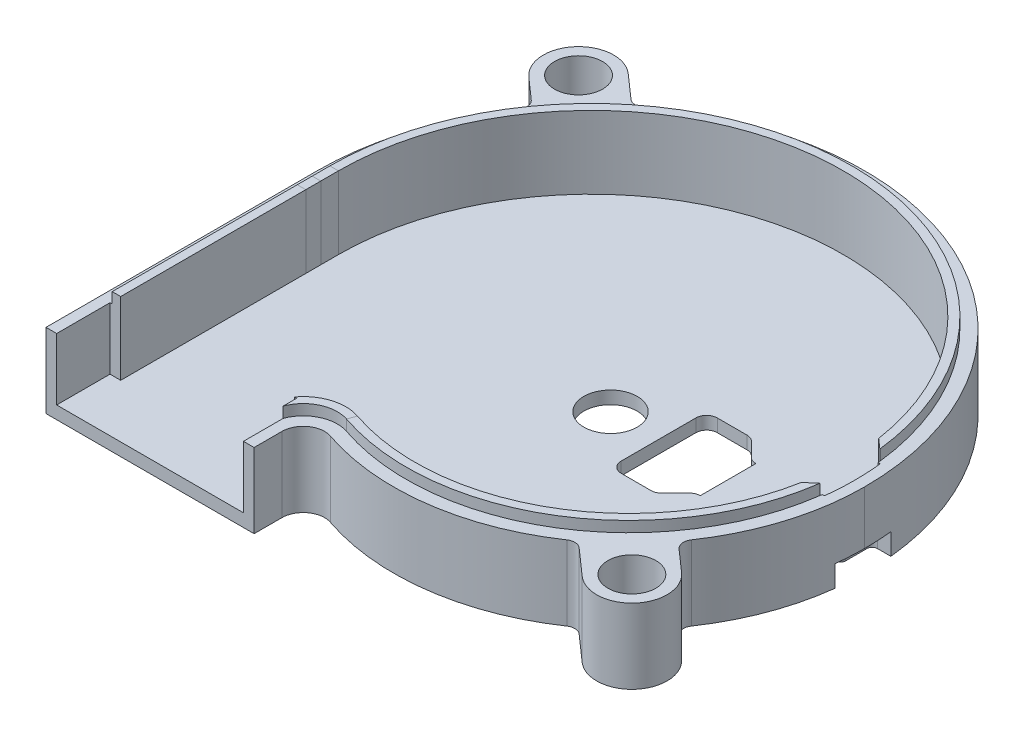
from build123d import *

# Parameters (mm, degrees)
SKETCH_1_R          = 2.25
SKETCH_1_R_2        = 2.5
EXTRUDE_1_DEPTH     = 8
CUT_EXTRUDE_1_DEPTH = 6.8
SKETCH_3_OUTSIDE_W  = 67.866
SKETCH_3_OUTSIDE_H  = 67.633
CUT_EXTRUDE_4_DEPTH = 1
SKETCH_5_R          = 2.825
SKETCH_5_R_2        = 2.25
EXTRUDE_2_DEPTH     = 1.5
CUT_EXTRUDE_5_DEPTH = 0.5
CUT_EXTRUDE_6_DEPTH = 2
FILLET_1_R          = 1
SKETCH_8_W          = 2.5
SKETCH_8_H          = 0.8
EXTRUDE_4_DEPTH     = 3
FILLET_2_R          = 0.5
CUT_EXTRUDE_7_DEPTH = 0.3
FILLET_3_R          = 0.1
FILLET_4_R          = 3
SKETCH_10_W         = 4.5
SKETCH_10_H         = 5.2
EXTRUDE_5_DEPTH     = 0.5
SKETCH2_W           = 1
SKETCH2_H           = 7.1
CUT_SWEEP1_START    = 7
CUT_SWEEP1_DEPTH    = 1
SKETCH5_R           = 2.825
CUT_EXTRUDE1_DEPTH  = 39.262710934
CUT_EXTRUDE2_REACH  = 40.458
BOSS_EXTRUDE2_REACH = 40.227
BOSS_EXTRUDE1_START = 0.5
BOSS_EXTRUDE1_DEPTH = 0.5
SKETCH_11_W         = 1
SKETCH_11_H         = 6.8
CUT_EXTRUDE_8_DEPTH = 5


# Read off the part's stored shape, not the designer's step: Cut-Sweep1
with BuildPart() as part:
    # Эскиз1 → Бобышка-Вытянуть1 (new body)
    with BuildSketch(Plane(origin=(0, 0, 0), x_dir=(1, 0, 0), z_dir=(0, 1, 0))):
        with BuildLine():
            Line((-27.5, -25.4), (-8, -25.4))
            Line((-8, -25.4), (-8, -22.792302991))
            ThreePointArc((-8, -22.792302991), (-7.16511566, -21.166724479), (-5.357494501, -20.89831601))
            ThreePointArc((-5.357494501, -20.89831601), (4.710003701, -21.866199594), (14.151976117, -18.241220202))
            ThreePointArc((14.151976117, -18.241220202), (14.777726241, -18.069792078), (15.376980036, -18.318480053))
            Line((15.376980036, -18.318480053), (17.814747272, -20.472785982))
            ThreePointArc((17.814747272, -20.472785982), (22.472785982, -20.185252728), (22.185252728, -15.527214018))
            Line((22.185252728, -15.527214018), (20.143734708, -13.723081814))
            ThreePointArc((20.143734708, -13.723081814), (19.813719174, -13.098302749), (19.979075206, -12.411340949))
            ThreePointArc((19.979075206, -12.411340949), (22.823148445, -6.493089604), (23.8, 0))
            ThreePointArc((23.8, 0), (9.576401492, 22.98111988), (-17.333078903, 20.466663618))
            ThreePointArc((-17.333078903, 20.466663618), (-17.974550182, 20.264645495), (-18.598905377, 20.514600122))
            Line((-18.598905377, 20.514600122), (-20.814747272, 22.472785982))
            ThreePointArc((-20.814747272, 22.472785982), (-25.472785982, 22.185252728), (-25.185252728, 17.527214018))
            Line((-25.185252728, 17.527214018), (-23.20688118, 15.778885673))
            ThreePointArc((-23.20688118, 15.778885673), (-22.876796583, 15.153555184), (-23.04284729, 14.466226133))
            ThreePointArc((-23.04284729, 14.466226133), (-26.362874376, 7.569397218), (-27.5, 0))
            Line((-27.5, 0), (-27.5, -25.4))
        make_face()
        with Locations(Location((-23, 20, 0), (0, 0, 270))):
            Circle(SKETCH_1_R, mode=Mode.SUBTRACT)
        with Locations(Location((20, -18, 0), (0, 0, 270))):
            Circle(SKETCH_1_R, mode=Mode.SUBTRACT)
        with Locations(Location((0, 0, 0), (0, 0, 270))):
            Circle(SKETCH_1_R_2, mode=Mode.SUBTRACT)
    extrude(amount=EXTRUDE_1_DEPTH)

    # Эскиз2 → Вырез-Вытянуть1 (cut)
    with BuildSketch(Plane(origin=(0, 8, 0), x_dir=(1, 0, 0), z_dir=(0, 1, 0))):
        with BuildLine():
            Line((-9, -25.4), (-9, -22.792302991))
            ThreePointArc((-9, -22.792302991), (-7.74767349, -20.353935223), (-5.036241751, -19.95132252))
            ThreePointArc((-5.036241751, -19.95132252), (4.575054369, -20.875347093), (13.589169994, -17.414631267))
            ThreePointArc((13.589169994, -17.414631267), (16.632858543, -14.893819788), (19.152217909, -11.84892917))
            ThreePointArc((19.152217909, -11.84892917), (21.867461922, -6.198703298), (22.799999997, 0.000326884))
            ThreePointArc((22.799999997, 0.000326884), (9.131074658, 22.085751778), (-16.729450225, 19.669398029))
            ThreePointArc((-16.729450225, 19.669398029), (-19.707335368, 17.009099388), (-22.216615604, 13.902895678))
            ThreePointArc((-22.216615604, 13.902895678), (-25.407255169, 7.27479247), (-26.500000107, 0.000327424))
            Line((-26.500000107, 0.000327424), (-26.5, -25.4))
            Line((-26.5, -25.4), (-9, -25.4))
        make_face()
    extrude(amount=-CUT_EXTRUDE_1_DEPTH, mode=Mode.SUBTRACT)

    # Эскиз3 outside → Вырез-Вытянуть4 (cut)
    with BuildSketch(Plane(origin=(0, 8, 0), x_dir=(1, 0, 0), z_dir=(0, 1, 0))):
        with Locations((-1.85, 0.1335)):
            Rectangle(SKETCH_3_OUTSIDE_W, SKETCH_3_OUTSIDE_H)
        with BuildLine():
            Line((-8.5, -25.4), (-8.5, -22.792302991))
            ThreePointArc((-8.5, -22.792302991), (-7.456394575, -20.760329851), (-5.196868126, -20.424819265))
            ThreePointArc((-5.196868126, -20.424819265), (14.296629108, -17.530257554), (23.3, 0.000122775))
            ThreePointArc((23.3, 0.000122775), (-1.849981192, 25.166802402), (-26.999999983, 0.000160392))
            Line((-26.999999983, 0.000160392), (-27.000000053, -25.4))
            Line((-27.000000053, -25.4), (-8.5, -25.4))
        make_face(mode=Mode.SUBTRACT)
    extrude(amount=-CUT_EXTRUDE_4_DEPTH, mode=Mode.SUBTRACT)

    # Эскиз5 → Бобышка-Вытянуть2 (add)
    # profile 1 of 2: a face of its own
    with BuildSketch(Plane(origin=(0, 7, 0), x_dir=(1, 0, 0), z_dir=(0, 1, 0))):
        with Locations(Location((20, -18, 0), (0, 0, 270))):
            Circle(SKETCH_5_R)
        with Locations(Location((20, -18, 0), (0, 0, 270))):
            Circle(SKETCH_5_R_2, mode=Mode.SUBTRACT)
    # profile 2 of 2: a face of its own
    with BuildSketch(Plane(origin=(0, 7, 0), x_dir=(1, 0, 0), z_dir=(0, 1, 0))):
        with Locations(Location((-23, 20, 0), (0, 0, 270))):
            Circle(SKETCH_5_R)
        with Locations(Location((-23, 20, 0), (0, 0, 270))):
            Circle(SKETCH_5_R_2, mode=Mode.SUBTRACT)
    extrude(amount=EXTRUDE_2_DEPTH)

    # Эскиз6 → Вырез-Вытянуть5 (cut)
    with BuildSketch(Plane.XZ):
        with BuildLine():
            Line((-8.124359088, -8.831465869), (-12.079320344, -12.786427125))
            Line((-12.079320344, -12.786427125), (-15.112213356, -15.819320137))
            ThreePointArc((-15.112213356, -15.819320137), (-8.444967684, -20.565662067), (-0.5, -22.529692378))
            Line((-0.5, -22.529692378), (-0.5, -18.690864606))
            Line((-0.5, -18.690864606), (-0.5, -11.989578808))
            ThreePointArc((-0.5, -11.989578808), (-4.592201188, -11.08655439), (-8.124359088, -8.831465869))
        make_face()
        with BuildLine():
            Line((-15.787974775, -15.080867994), (-12.786427125, -12.079320344))
            Line((-12.786427125, -12.079320344), (-8.831465869, -8.124359088))
            ThreePointArc((-8.831465869, -8.124359088), (-11.08655439, -4.592201188), (-11.989578808, -0.5))
            Line((-11.989578808, -0.5), (-19.679374583, -0.5))
            Line((-19.679374583, -0.5), (-21.191246789, -0.5))
            ThreePointArc((-21.191246789, -0.5), (-19.828810643, -8.286704941), (-15.787974775, -15.080867994))
        make_face()
        with BuildLine():
            Line((-21.159916823, 0.5), (-19.679374583, 0.5))
            Line((-19.679374583, 0.5), (-11.989578808, 0.5))
            ThreePointArc((-11.989578808, 0.5), (-11.08655439, 4.592201188), (-8.831465869, 8.124359088))
            Line((-8.831465869, 8.124359088), (-11.509243088, 10.802136307))
            Line((-11.509243088, 10.802136307), (-15.133940377, 14.426833596))
            ThreePointArc((-15.133940377, 14.426833596), (-19.393122123, 8.00263002), (-21.159916823, 0.5))
        make_face()
        with BuildLine():
            Line((-14.426833596, 15.133940377), (-10.802136307, 11.509243088))
            Line((-10.802136307, 11.509243088), (-8.124359088, 8.831465869))
            ThreePointArc((-8.124359088, 8.831465869), (-4.592201188, 11.08655439), (-0.5, 11.989578808))
            Line((-0.5, 11.989578808), (-0.5, 17.569097793))
            Line((-0.5, 17.569097793), (-0.5, 21.159916823))
            ThreePointArc((-0.5, 21.159916823), (-8.00263002, 19.393122123), (-14.426833596, 15.133940377))
        make_face()
        with BuildLine():
            Line((0.5, 21.191246789), (0.5, 17.569097793))
            Line((0.5, 17.569097793), (0.5, 11.989578808))
            ThreePointArc((0.5, 11.989578808), (4.592201188, 11.08655439), (8.124359088, 8.831465869))
            Line((8.124359088, 8.831465869), (11.227255938, 11.93436272))
            Line((11.227255938, 11.93436272), (15.080867994, 15.787974775))
            ThreePointArc((15.080867994, 15.787974775), (8.286704941, 19.828810643), (0.5, 21.191246789))
        make_face()
        with BuildLine():
            Line((11.522911958, 3.35), (18.148882908, 3.35))
            Line((18.148882908, 3.35), (22.186495338, 3.35))
            ThreePointArc((22.186495338, 3.35), (19.923839699, 9.729629785), (15.819320137, 15.112213356))
            Line((15.819320137, 15.112213356), (11.93436272, 11.227255938))
            Line((11.93436272, 11.227255938), (8.831465869, 8.124359088))
            ThreePointArc((8.831465869, 8.124359088), (10.453410944, 5.892893995), (11.522911958, 3.35))
        make_face()
        with BuildLine():
            Line((8.831465869, -8.124359088), (10.382914295, -9.675807513))
            Line((10.382914295, -9.675807513), (16.503715933, -15.796609151))
            ThreePointArc((16.503715933, -15.796609151), (20.456263822, -10.049295735), (22.398860789, -3.35))
            Line((22.398860789, -3.35), (18.148882908, -3.35))
            Line((18.148882908, -3.35), (11.522911958, -3.35))
            ThreePointArc((11.522911958, -3.35), (10.453410944, -5.892893995), (8.831465869, -8.124359088))
        make_face()
        with BuildLine():
            Line((0.5, -11.989578808), (0.5, -18.690864606))
            Line((0.5, -18.690864606), (0.5, -22.561022344))
            ThreePointArc((0.5, -22.561022344), (8.739410144, -21.025097131), (15.796609151, -16.503715933))
            Line((15.796609151, -16.503715933), (9.675807513, -10.382914295))
            Line((9.675807513, -10.382914295), (8.124359088, -8.831465869))
            ThreePointArc((8.124359088, -8.831465869), (4.592201188, -11.08655439), (0.5, -11.989578808))
        make_face()
    extrude(amount=-CUT_EXTRUDE_5_DEPTH, mode=Mode.SUBTRACT)

    # Эскиз7 → Вырез-Вытянуть6 (cut)
    with BuildSketch(Plane.XZ):
        with BuildLine():
            Line((23.669597249, -2.6), (10.6, -2.6))
            Line((10.6, -2.6), (8.7, -4.5))
            Line((8.7, -4.5), (4.5, -4.5))
            Line((4.5, -4.5), (4.5, 4.5))
            Line((4.5, 4.5), (8.7, 4.5))
            Line((8.7, 4.5), (10.6, 2.6))
            Line((10.6, 2.6), (23.646302286, 2.6))
            ThreePointArc((23.646302286, 2.6), (23.761542061, 1.30226946), (23.8, 0))
            ThreePointArc((23.8, 0), (23.767804759, -1.30165542), (23.669597249, -2.6))
        make_face()
    extrude(amount=-CUT_EXTRUDE_6_DEPTH, mode=Mode.SUBTRACT)

    # Скругление1
    fillet_1_edges = [part.edges().sort_by_distance(p)[0] for p in [
        (10.6, 0.6, -2.6),
        (8.7, 0.6, -4.5),
        (4.5, 0.6, -4.5),
        (4.5, 0.6, 4.5),
        (8.7, 0.6, 4.5),
        (10.6, 0.6, 2.6),
    ]]
    fillet(fillet_1_edges, radius=FILLET_1_R)

    # Эскиз8 → Бобышка-Вытянуть4 (add)
    with BuildSketch(Plane.XY.offset(-2.6)):
        with Locations((20.669597249, 0.4)):
            Rectangle(SKETCH_8_W, SKETCH_8_H)
    extrude(amount=EXTRUDE_4_DEPTH)

    # Скругление2
    fillet_2_edges = [part.edges().sort_by_distance(p)[0] for p in [
        (21.919597249, 0.4, -2.6),
        (19.419597249, 0.4, -2.6),
        (21.919597249, 0.4, 0.4),
        (19.419597249, 0.4, 0.4),
    ]]
    fillet(fillet_2_edges, radius=FILLET_2_R)

    # Эскиз9 → Вырез-Вытянуть7 (cut)
    with BuildSketch(Plane(origin=(0, 1.2, 0), x_dir=(1, 0, 0), z_dir=(0, 1, 0))):
        with BuildLine():
            Line((-9, -22.792302991), (-9, -25.4))
            Line((-9, -25.4), (-26.500000053, -25.4))
            Line((-26.500000053, -25.4), (-26.500000053, 0.000327424))
            ThreePointArc((-26.500000053, 0.000327424), (-21.616141743, -14.364380593), (-9, -22.792302991))
        make_face()
    extrude(amount=-CUT_EXTRUDE_7_DEPTH, mode=Mode.SUBTRACT)

    # Скругление3
    fillet_3_edges = [part.edges().sort_by_distance(p)[0] for p in [
        (-26.500000053, 1.05, -0.000327424),
    ]]
    fillet(fillet_3_edges, radius=FILLET_3_R)

    # Скругление4
    # the kernel refuses this fillet: 3 mm, written as the material it takes off along each edge
    with BuildSketch(Plane(origin=(-26.400000053, 1.2, 3.057274541), x_dir=(0.992360523213108, 0, -0.1233717632532123), z_dir=(-0.1233717632532123, 0, -0.992360523213108))) as fillet_4_piece_1_section:
        with BuildLine():
            CenterArc((-1.407669683, 3), FILLET_4_R, 270, 25.841932763)
            Line((-0.1, 0.3), (-0.1, 0))
            Line((-0.1, 0), (-1.407669683, 0))
        make_face()
    fillet_4_piece_1 = revolve(axis=Axis((-26.400000053, 1.2, 3.057274541), (0, -1, 0)), revolution_arc=359.64, mode=Mode.PRIVATE)
    fillet_4_piece_1 = split(fillet_4_piece_1, bisect_by=Plane(origin=(-26.500000097, 1.12988638, 2.323319391), z_dir=(1.0, 0, -4.220683577170919e-09)), keep=Keep.TOP, mode=Mode.PRIVATE)
    add(fillet_4_piece_1, mode=Mode.SUBTRACT)
    with BuildSketch(Plane(origin=(-2.886480145, 1.2, -0.01610437), x_dir=(-0.9915657723161722, 0, 0.12960447203331021), z_dir=(-0.12960447203331021, 0, -0.9915657723161722))) as fillet_4_piece_2_section:
        with BuildLine():
            CenterArc((22.305855495, -3), FILLET_4_R, 64.158067237, 25.841932763)
            Line((23.613525178, -0.3), (23.613525178, 0))
            Line((23.613525178, 0), (22.305855495, 0))
        make_face()
    fillet_4_piece_2 = revolve(axis=Axis((-2.886480145, 1.2, -0.01610437), (0, 1, 0)), revolution_arc=75.482624122, mode=Mode.PRIVATE)
    fillet_4_piece_2 = fillet_4_piece_2 - Plane(origin=(-6, 1.12988638, 22.792302991), x_dir=(-1, 0, 0), z_dir=(0, 1, 0)) * Cylinder(3, 95, mode=Mode.PRIVATE)
    add(fillet_4_piece_2, mode=Mode.SUBTRACT)



with BuildPart() as body_2:
    # Эскиз10 → Бобышка-Вытянуть5 (new body)
    with BuildSketch(Plane(origin=(0, 1.2, 0), x_dir=(1, 0, 0), z_dir=(0, 1, 0))):
        with Locations((13.264213562, 0)):
            Rectangle(SKETCH_10_W, SKETCH_10_H)
    extrude(amount=-EXTRUDE_5_DEPTH)


with BuildPart() as part_1:
    add(part.part)

    add(body_2.part)  # Sweep1 merges body 2
    # Sweep1: sweep along a path in Sketch1
    with BuildLine(Plane(origin=(0, 1.2, 0), x_dir=(1, 0, 0), z_dir=(0, 1, 0))) as sweep1_path:
        Line((-26.500000053, -25.4), (-26.500000053, -3.057274222))
        Line((-26.500000053, -3.057274222), (-26.5000001, -1.653161001))
        Line((-26.5000001, -1.653161001), (-26.500000053, 0.000327424))
        ThreePointArc((-26.500000053, 0.000327424), (-3.1516065, 24.632413754), (22.664278196, 2.6))
        Line((22.664278196, 2.6), (11.014213562, 2.6))
        ThreePointArc((11.014213562, 2.6), (10.63153013, 2.676120467), (10.307106781, 2.892893219))
        Line((10.307106781, 2.892893219), (8.992893219, 4.207106781))
        ThreePointArc((8.992893219, 4.207106781), (8.66846987, 4.423879533), (8.285786438, 4.5))
        Line((8.285786438, 4.5), (5.5, 4.5))
        ThreePointArc((5.5, 4.5), (4.792893219, 4.207106781), (4.5, 3.5))
        Line((4.5, 3.5), (4.5, -3.5))
        ThreePointArc((4.5, -3.5), (4.792893219, -4.207106781), (5.5, -4.5))
        Line((5.5, -4.5), (8.285786438, -4.5))
        ThreePointArc((8.285786438, -4.5), (8.66846987, -4.423879533), (8.992893219, -4.207106781))
        Line((8.992893219, -4.207106781), (10.307106781, -2.892893219))
        ThreePointArc((10.307106781, -2.892893219), (10.63153013, -2.676120467), (11.014213562, -2.6))
        Line((11.014213562, -2.6), (22.638952089, -2.6))
        ThreePointArc((22.638952089, -2.6), (12.923171816, -17.849919478), (-5.036241751, -19.95132252))
        ThreePointArc((-5.036241751, -19.95132252), (-7.173656162, -20.0314098), (-8.714467978, -21.51493711))
        ThreePointArc((-8.714467978, -21.51493711), (-8.92774691, -22.137858163), (-9, -22.792302991))
        Line((-9, -22.792302991), (-9, -25.4))
    # Sketch2 → Sweep1 (sweep)
    with BuildSketch(Plane.XY.offset(25.4)):
        with Locations((-26.000000053, 4.45)):
            Rectangle(SKETCH2_W, SKETCH2_H)
    sweep(path=sweep1_path.line, transition=Transition.RIGHT)

    # Cut-Sweep1 outline → Cut-Sweep1 (cut)
    with BuildSketch(Plane(origin=(0, 0, 0), x_dir=(1, 0, 0), z_dir=(0, 1, 0)).offset(CUT_SWEEP1_START)):
        with BuildLine():
            ThreePointArc((22.437396466, -2.6), (12.80639373, -17.687072715), (-4.971991179, -19.761923752))
            ThreePointArc((-4.971991179, -19.761923752), (-7.864185099, -20.191377313), (-9.200000073, -22.792302992))
            Line((-9.200000073, -22.792302992), (-9.200000073, -25.4))
            Line((-9.200000073, -25.4), (-8.5, -25.4))
            Line((-8.5, -25.4), (-8.5, -22.792302991))
            ThreePointArc((-8.5, -22.792302991), (-7.456394575, -20.760329851), (-5.196868126, -20.424819265))
            ThreePointArc((-5.196868126, -20.424819265), (14.296629108, -17.530257554), (23.3, 0.000122775))
            ThreePointArc((23.3, 0.000122775), (-1.849981192, 25.166802381), (-27.000000004, 0.000160391))
            Line((-27.000000004, 0.000160391), (-27.000000053, -25.4))
            Line((-27.000000053, -25.4), (-26.3, -25.4))
            Line((-26.3, -25.4), (-26.29999995, 0.000391914))
            ThreePointArc((-26.29999995, 0.000391914), (-3.151603523, 24.432132117), (22.463161627, 2.6))
            Line((22.463161627, 2.6), (22.664278196, 2.6))
            ThreePointArc((22.664278196, 2.6), (22.766481044, 1.30195634), (22.800000052, 0.000326884))
            ThreePointArc((22.800000052, 0.000326884), (22.759709581, -1.302328371), (22.638952089, -2.6))
            Line((22.638952089, -2.6), (22.437396466, -2.6))
        make_face()
    extrude(amount=CUT_SWEEP1_DEPTH, mode=Mode.SUBTRACT)

    # Sketch5 → Cut-Extrude1 (cut, through all)
    with BuildSketch(Plane(origin=(0, 7, 0), x_dir=(1, 0, 0), z_dir=(0, 1, 0))):
        with Locations((-23, 20)):
            Circle(SKETCH5_R)
        with Locations((20, -18)):
            Circle(SKETCH5_R)
    extrude(amount=CUT_EXTRUDE1_DEPTH, mode=Mode.SUBTRACT)

    # Cut-Extrude2: up to this face of the body (flat: up to its plane)
    cut_extrude2_end = Plane(part_1.part.faces().sort_by_distance((-3.353641126, 1.2, -1.27781855))[0])
    # Sketch6 → Cut-Extrude2 (cut, up to the picked face)
    with BuildSketch(Plane(origin=(0, 8, 0), x_dir=(1, 0, 0), z_dir=(0, 1, 0)), mode=Mode.PRIVATE) as cut_extrude2_sk1:
        with BuildLine():
            Line((8.285786438, 5.5), (5.5, 5.5))
            ThreePointArc((5.5, 5.5), (4.085786438, 4.914213562), (3.5, 3.5))
            Line((3.5, 3.5), (3.5, -3.5))
            ThreePointArc((3.5, -3.5), (4.085786438, -4.914213562), (5.5, -5.5))
            Line((5.5, -5.5), (8.285786438, -5.5))
            ThreePointArc((8.285786438, -5.5), (9.051153302, -5.347759065), (9.7, -4.914213562))
            Line((9.7, -4.914213562), (11.014213562, -3.6))
            Line((11.014213562, -3.6), (11.014213562, -2.6))
            ThreePointArc((11.014213562, -2.6), (10.63153013, -2.676120467), (10.307106781, -2.892893219))
            Line((10.307106781, -2.892893219), (8.992893219, -4.207106781))
            ThreePointArc((8.992893219, -4.207106781), (8.66846987, -4.423879533), (8.285786438, -4.5))
            Line((8.285786438, -4.5), (5.5, -4.5))
            ThreePointArc((5.5, -4.5), (4.792893219, -4.207106781), (4.5, -3.5))
            Line((4.5, -3.5), (4.5, 3.5))
            ThreePointArc((4.5, 3.5), (4.792893219, 4.207106781), (5.5, 4.5))
            Line((5.5, 4.5), (8.285786438, 4.5))
            ThreePointArc((8.285786438, 4.5), (8.66846987, 4.423879533), (8.992893219, 4.207106781))
            Line((8.992893219, 4.207106781), (10.307106781, 2.892893219))
            ThreePointArc((10.307106781, 2.892893219), (10.63153013, 2.676120467), (11.014213562, 2.6))
            Line((11.014213562, 2.6), (22.463161627, 2.6))
            ThreePointArc((22.463161627, 2.6), (22.452556294, 2.69793922), (22.44155644, 2.795834914))
            Line((22.44155644, 2.795834914), (21.526984795, 3.6))
            Line((21.526984795, 3.6), (11.014213562, 3.6))
            Line((11.014213562, 3.6), (9.7, 4.914213562))
            ThreePointArc((9.7, 4.914213562), (9.051153302, 5.347759065), (8.285786438, 5.5))
        make_face()
    cut_extrude2_tool1 = split(extrude(cut_extrude2_sk1.sketch, amount=-CUT_EXTRUDE2_REACH, mode=Mode.PRIVATE), bisect_by=cut_extrude2_end, keep=Keep.BOTH, mode=Mode.PRIVATE)
    # Sketch6 → Cut-Extrude2 (cut, up to the picked face)
    with BuildSketch(Plane(origin=(0, 8, 0), x_dir=(1, 0, 0), z_dir=(0, 1, 0)), mode=Mode.PRIVATE) as cut_extrude2_sk2:
        with BuildLine():
            Line((11.014213562, -3.6), (21.474458504, -3.6))
            Line((21.474458504, -3.6), (22.41198953, -2.794902369))
            ThreePointArc((22.41198953, -2.794902369), (22.424922467, -2.697481098), (22.437396466, -2.6))
            Line((22.437396466, -2.6), (11.014213562, -2.6))
            Line((11.014213562, -2.6), (11.014213562, -3.6))
        make_face()
    cut_extrude2_tool2 = split(extrude(cut_extrude2_sk2.sketch, amount=-CUT_EXTRUDE2_REACH, mode=Mode.PRIVATE), bisect_by=cut_extrude2_end, keep=Keep.BOTH, mode=Mode.PRIVATE)
    add(cut_extrude2_tool1.solids().sort_by(Axis((6.892893, 8, -5.280774), (0, -1, 0)))[0], mode=Mode.SUBTRACT)
    add(cut_extrude2_tool2.solids().sort_by(Axis((16.52998, 8, 3.09197), (0, -1, 0)))[0], mode=Mode.SUBTRACT)

    # Sketch8 → Boss-Extrude2 (add, up to next)
    with BuildSketch(Plane(origin=(0, 1.2, 0), x_dir=(1, 0, 0), z_dir=(0, 1, 0)), mode=Mode.PRIVATE) as boss_extrude2_sk1:
        with BuildLine():
            Line((-25.500000057, -2.939638034), (-25.500000089, -1.974900013))
            ThreePointArc((-25.500000089, -1.974900013), (-25.167059975, -2.378015361), (-25.004203015, -2.874833954))
            ThreePointArc((-25.004203015, -2.874833954), (-20.010058003, -14.278449513), (-9.682030795, -21.229405291))
            ThreePointArc((-9.682030795, -21.229405291), (-9.888367335, -21.853900378), (-9.989579706, -22.5037657))
            ThreePointArc((-9.989579706, -22.5037657), (-9.997394078, -22.647940296), (-10, -22.792302991))
            Line((-10, -22.792302991), (-10, -25.4))
            Line((-10, -25.4), (-25.500000053, -25.4))
            Line((-25.500000053, -25.4), (-25.500000053, -6.782960914))
            Line((-25.500000053, -6.782960914), (-25.500000053, -3.057274188))
            Line((-25.500000053, -3.057274188), (-25.500000057, -2.939638034))
        make_face()
    boss_extrude2_tool1 = extrude(boss_extrude2_sk1.sketch, amount=-BOSS_EXTRUDE2_REACH, mode=Mode.PRIVATE) - part_1.part
    add(boss_extrude2_tool1.solids().sort_by_distance((-19.853848, 1.2, 19.032769))[0])

    # Sketch7 → Boss-Extrude1 (add)
    with BuildSketch(Plane.XZ.offset(-0.5).offset(BOSS_EXTRUDE1_START)):
        with BuildLine():
            Line((0.5, -11.989578808), (0.5, -22.561022344))
            ThreePointArc((0.5, -22.561022344), (8.739410144, -21.025097131), (15.796609151, -16.503715933))
            Line((15.796609151, -16.503715933), (8.124359088, -8.831465869))
            ThreePointArc((8.124359088, -8.831465869), (4.592201188, -11.08655439), (0.5, -11.989578808))
        make_face()
        with BuildLine():
            Line((8.831465869, -8.124359088), (16.503715933, -15.796609151))
            ThreePointArc((16.503715933, -15.796609151), (20.456263822, -10.049295735), (22.398860789, -3.35))
            Line((22.398860789, -3.35), (11.522911958, -3.35))
            ThreePointArc((11.522911958, -3.35), (10.453410944, -5.892893995), (8.831465869, -8.124359088))
        make_face()
        with BuildLine():
            Line((11.522911958, 3.35), (22.186495338, 3.35))
            ThreePointArc((22.186495338, 3.35), (19.923839699, 9.729629785), (15.819320137, 15.112213356))
            Line((15.819320137, 15.112213356), (8.831465869, 8.124359088))
            ThreePointArc((8.831465869, 8.124359088), (10.453410944, 5.892893995), (11.522911958, 3.35))
        make_face()
        with BuildLine():
            Line((8.124359088, 8.831465869), (15.080867994, 15.787974775))
            ThreePointArc((15.080867994, 15.787974775), (8.286704941, 19.828810643), (0.5, 21.191246789))
            Line((0.5, 21.191246789), (0.5, 11.989578808))
            ThreePointArc((0.5, 11.989578808), (4.592201188, 11.08655439), (8.124359088, 8.831465869))
        make_face()
        with BuildLine():
            Line((-0.5, 11.989578808), (-0.5, 21.159916823))
            ThreePointArc((-0.5, 21.159916823), (-8.00263002, 19.393122123), (-14.426833596, 15.133940377))
            Line((-14.426833596, 15.133940377), (-8.124359088, 8.831465869))
            ThreePointArc((-8.124359088, 8.831465869), (-4.592201188, 11.08655439), (-0.5, 11.989578808))
        make_face()
        with BuildLine():
            Line((-8.831465869, 8.124359088), (-15.133940377, 14.426833596))
            ThreePointArc((-15.133940377, 14.426833596), (-19.393122123, 8.00263002), (-21.159916823, 0.5))
            Line((-21.159916823, 0.5), (-11.989578808, 0.5))
            ThreePointArc((-11.989578808, 0.5), (-11.08655439, 4.592201188), (-8.831465869, 8.124359088))
        make_face()
        with BuildLine():
            Line((-11.989578808, -0.5), (-21.191246789, -0.5))
            ThreePointArc((-21.191246789, -0.5), (-19.828810643, -8.286704941), (-15.787974775, -15.080867994))
            Line((-15.787974775, -15.080867994), (-8.831465869, -8.124359088))
            ThreePointArc((-8.831465869, -8.124359088), (-11.08655439, -4.592201188), (-11.989578808, -0.5))
        make_face()
        with BuildLine():
            Line((-8.124359088, -8.831465869), (-15.112213356, -15.819320137))
            ThreePointArc((-15.112213356, -15.819320137), (-8.444967684, -20.565662067), (-0.5, -22.529692378))
            Line((-0.5, -22.529692378), (-0.5, -11.989578808))
            ThreePointArc((-0.5, -11.989578808), (-4.592201188, -11.08655439), (-8.124359088, -8.831465869))
        make_face()
    extrude(amount=-BOSS_EXTRUDE1_DEPTH)

    # Эскиз11 → Вырез-Вытянуть8 (cut)
    with BuildSketch(Plane.XY.offset(25.4)):
        with Locations((-26.000000026, 4.6)):
            Rectangle(SKETCH_11_W, SKETCH_11_H)
        with Locations((-9.500000026, 4.6)):
            Rectangle(SKETCH_11_W, SKETCH_11_H)
    extrude(amount=-CUT_EXTRUDE_8_DEPTH, mode=Mode.SUBTRACT)


solid = part_1.part
